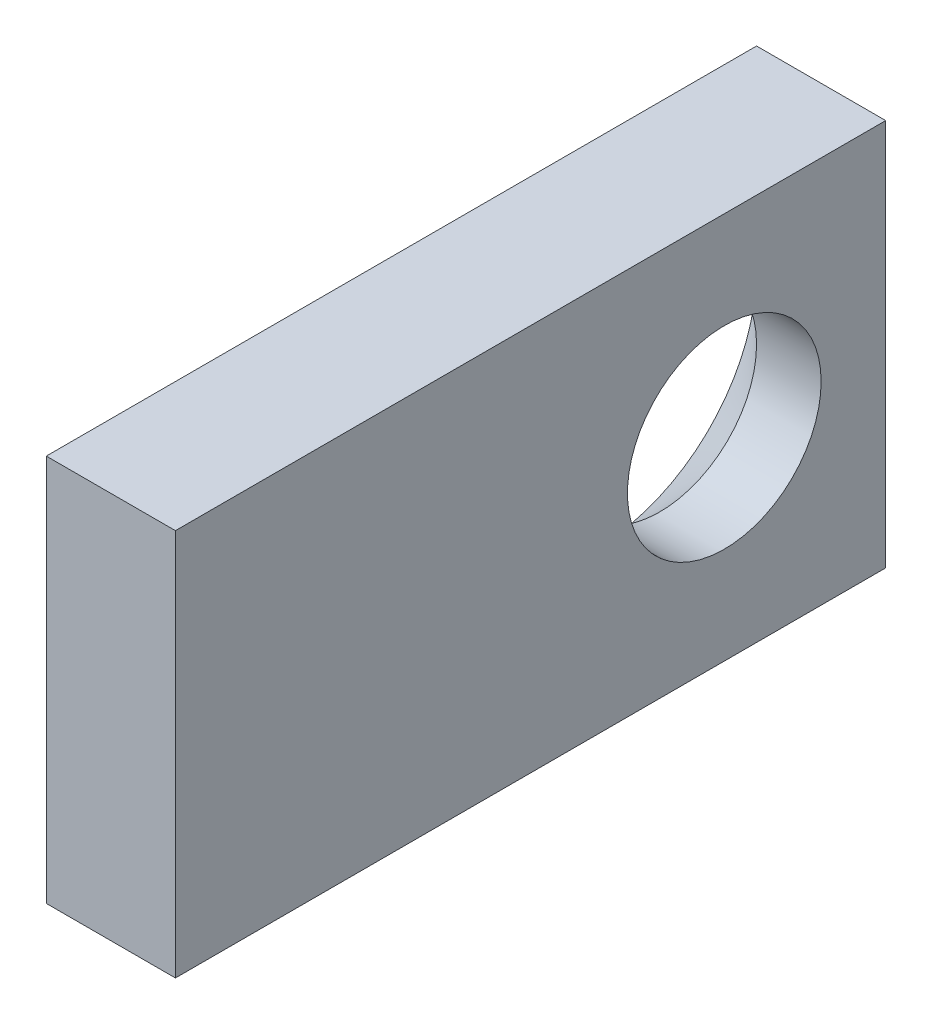
from build123d import *

# Parameters (mm, degrees)
SKETCH_1_W      = 11
SKETCH_1_H      = 6
SKETCH_1_R      = 1.5
EXTRUDE_1_DEPTH = 2
CHAMFER_1_SIZE  = 1


with BuildPart() as part:
    # Эскиз1 → Бобышка-Вытянуть1 (new body)
    with BuildSketch(Plane(origin=(0, 0, 0), x_dir=(0, 0, -1), z_dir=(1, 0, 0))):
        with Locations((-5.5, 3)):
            Rectangle(SKETCH_1_W, SKETCH_1_H)
        with Locations((-2.5, 3)):
            Circle(SKETCH_1_R, mode=Mode.SUBTRACT)
    extrude(amount=EXTRUDE_1_DEPTH)

    # Фаска1
    chamfer_1_edges = [part.edges().sort_by_distance(p)[0] for p in [
        (0, 3, 4),
    ]]
    chamfer(chamfer_1_edges, length=CHAMFER_1_SIZE - 0.0001)  # a hair under: the kernel refuses the full size


solid = part.part
